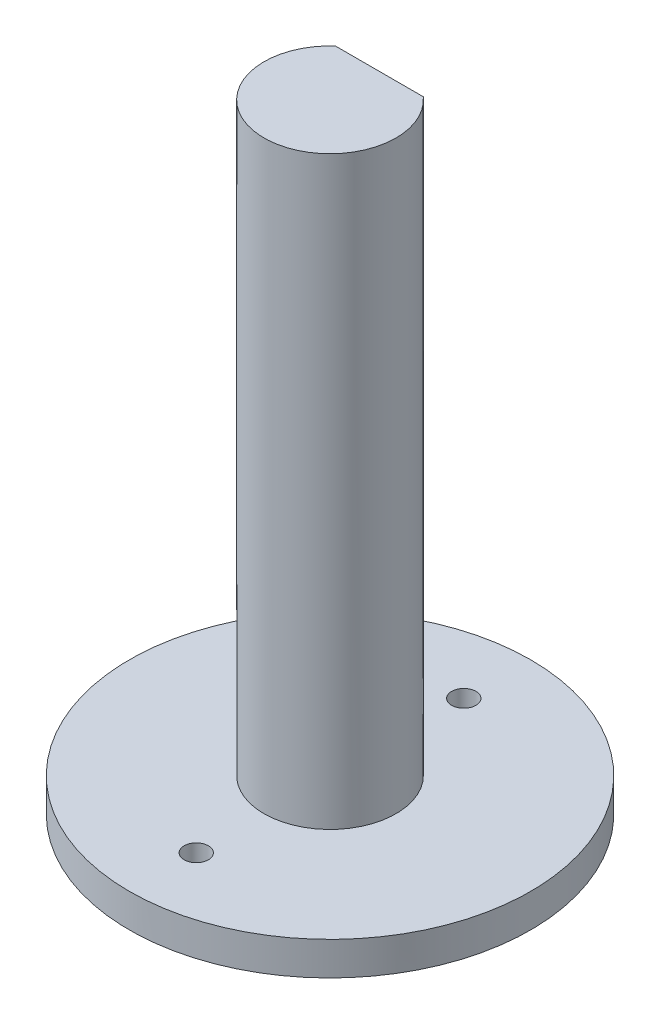
from build123d import *

# Parameters (mm, degrees)
CROQUIS3_R                 = 12
SALIENTE_EXTRUIR1_DEPTH    = 4
CROQUIS4_R                 = 3.95
SALIENTE_EXTRUIR2_DEPTH    = 35
CORTAR_EXTRUIR1_START      = -20
CORTAR_EXTRUIR1_DEPTH      = 20
CROQUIS7_R                 = 12
CORTAR_EXTRUIR2_DEPTH      = 2
CORTAR_EXTRUIR3_DEPTH      = 41.706264874
CORTAR_EXTRUIR3_DEPTH_BACK = 41.706264874
CROQUIS8_R                 = 0.726366889


with BuildPart() as part:
    # Croquis3 → Saliente-Extruir1 (new body)
    with BuildSketch(Plane(origin=(0, 0, 0), x_dir=(1, 0, 0), z_dir=(0, 1, 0))):
        Circle(CROQUIS3_R)
    extrude(amount=SALIENTE_EXTRUIR1_DEPTH)

    # Croquis4 → Saliente-Extruir2 (add)
    with BuildSketch(Plane(origin=(0, 4, 0), x_dir=(1, 0, 0), z_dir=(0, 1, 0))):
        Circle(CROQUIS4_R)
    extrude(amount=SALIENTE_EXTRUIR2_DEPTH)

    # Croquis5 → Cortar-Extruir1 (cut)
    with BuildSketch(Plane(origin=(0, 39, 0), x_dir=(1, 0, 0), z_dir=(0, 1, 0)).offset(CORTAR_EXTRUIR1_START)):
        with BuildLine():
            Line((2.626785107, 2.95), (-2.626785107, 2.95))
            ThreePointArc((-2.626785107, 2.95), (0, 3.95), (2.626785107, 2.95))
        make_face()
    extrude(amount=CORTAR_EXTRUIR1_DEPTH, mode=Mode.SUBTRACT)

    # Croquis7 → Cortar-Extruir2 (cut)
    with BuildSketch(Plane.XZ):
        Circle(CROQUIS7_R)
    extrude(amount=-CORTAR_EXTRUIR2_DEPTH, mode=Mode.SUBTRACT)

    # Croquis8 → Cortar-Extruir3 (cut, two sides: drawn at the far end of the back side and taken through both)
    with BuildSketch(Plane.XZ.offset(-2).offset(-CORTAR_EXTRUIR3_DEPTH_BACK)):
        with Locations((0, 8)):
            Circle(CROQUIS8_R)
        with Locations((0, -8)):
            Circle(CROQUIS8_R)
    extrude(amount=CORTAR_EXTRUIR3_DEPTH + CORTAR_EXTRUIR3_DEPTH_BACK, mode=Mode.SUBTRACT)


solid = part.part
